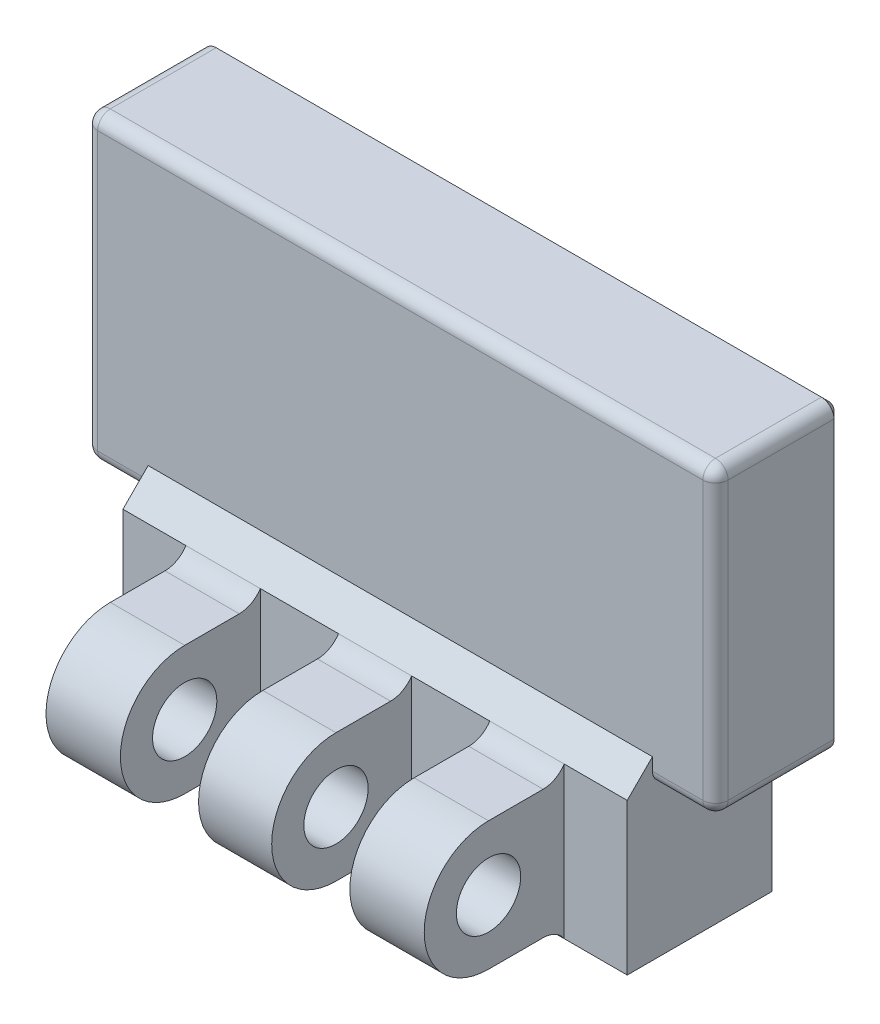
from build123d import *

# Parameters (mm, degrees)
SKETCH1_W           = 40
SKETCH1_H           = 12
SKETCH1_R           = 4.05
BOSS_EXTRUDE1_DEPTH = 6
SKETCH3_R           = 2.55
BOSS_EXTRUDE2_DEPTH = 15
CUT_EXTRUDE1_START  = -2.9
SKETCH3_2_R         = 2.55
CUT_EXTRUDE1_DEPTH  = 6.2
BOSS_EXTRUDE3_START = -3
SKETCH5_R           = 4.05
BOSS_EXTRUDE3_DEPTH = 3
SKETCH6_W           = 50
SKETCH6_H           = 24
BOSS_EXTRUDE4_DEPTH = 10
SKETCH8_W           = 11
SKETCH8_H           = 12
CUT_EXTRUDE2_DEPTH  = 8
CHAMFER1_SIZE       = 2
FILLET1_R           = 1
FILLET2_R           = 1
CHAMFER2_SIZE       = 0.6
CHAMFER3_SIZE       = 0.5
FILLET3_R           = 2


# Some blends are built 0.0001 mm under size
with BuildPart() as part:
    # Sketch1 → Boss-Extrude1 (new, symmetric)
    with BuildSketch(Plane.XY):
        Rectangle(SKETCH1_W, SKETCH1_H)
        with Locations((11, 0)):
            Circle(SKETCH1_R, mode=Mode.SUBTRACT)
        with Locations(Location((-11, 0, 0), (0, 0, 180))):
            Circle(SKETCH1_R, mode=Mode.SUBTRACT)
    extrude(amount=BOSS_EXTRUDE1_DEPTH, both=True)

    # Sketch3 → Boss-Extrude2 (add, symmetric)
    with BuildSketch(Plane(origin=(0, 0, 0), x_dir=(0, 0, -1), z_dir=(1, 0, 0))):
        with BuildLine():
            Line((-12, -5.1), (-6, -5.1))
            Line((-6, -5.1), (-6, 5.1))
            Line((-6, 5.1), (-12, 5.1))
            ThreePointArc((-12, 5.1), (-17.1, 0), (-12, -5.1))
        make_face()
        with Locations((-12, 0)):
            Circle(SKETCH3_R, mode=Mode.SUBTRACT)
    extrude(amount=BOSS_EXTRUDE2_DEPTH, both=True)

    # Sketch3<2> → Cut-Extrude1 (cut)
    with BuildSketch(Plane(origin=(0, 0, 0), x_dir=(0, 0, -1), z_dir=(1, 0, 0)).offset(CUT_EXTRUDE1_START)):
        with BuildLine():
            Line((-12, -5.1), (-6, -5.1))
            Line((-6, -5.1), (-6, 5.1))
            Line((-6, 5.1), (-12, 5.1))
            ThreePointArc((-12, 5.1), (-17.1, 0), (-12, -5.1))
        make_face()
        with Locations((-12, 0)):
            Circle(SKETCH3_2_R, mode=Mode.SUBTRACT)
    cut_extrude1 = extrude(amount=-CUT_EXTRUDE1_DEPTH, mode=Mode.SUBTRACT)

    # Mirror1: Cut-Extrude1 across plane
    add(cut_extrude1.mirror(Plane(origin=(0, 0, 0), x_dir=(0, 0, 1), z_dir=(1, 0, 0))), mode=Mode.SUBTRACT)

    # Sketch5 → Boss-Extrude3 (add)
    with BuildSketch(Plane.XY.offset(6).offset(BOSS_EXTRUDE3_START)):
        with Locations(Location((-11, 0, 0), (0, 0, 180))):
            Circle(SKETCH5_R)
        with Locations((11, 0)):
            Circle(SKETCH5_R)
    extrude(amount=BOSS_EXTRUDE3_DEPTH)

    # Sketch6 → Boss-Extrude4 (add)
    with BuildSketch(Plane(origin=(0, 0, -6), x_dir=(-1, 0, 0), z_dir=(0, 0, -1))):
        with Locations((0, 18)):
            Rectangle(SKETCH6_W, SKETCH6_H)
    extrude(amount=-BOSS_EXTRUDE4_DEPTH)

    # Sketch8 → Cut-Extrude2 (cut)
    with BuildSketch(Plane(origin=(0, 0, -6), x_dir=(-1, 0, 0), z_dir=(0, 0, -1))):
        Rectangle(SKETCH8_W, SKETCH8_H)
        Polygon((-23, 27), (-23, 6), (-20, 6), (-5.5, 6), (5.5, 6), (20, 6), (23, 6), (23, 27), align=None)
    extrude(amount=-CUT_EXTRUDE2_DEPTH, mode=Mode.SUBTRACT)

    # Chamfer1
    chamfer1_edges = [part.edges().sort_by_distance(p)[0] for p in [
        (0, 6, 4),
    ]]
    chamfer(chamfer1_edges, length=CHAMFER1_SIZE - 0.0001)  # a hair under: the kernel refuses the full size

    # Fillet1
    fillet1_edges = [part.edges().sort_by_distance(p)[0] for p in [
        (25, 18, 4),
        (0, 30, 4),
        (-25, 18, 4),
    ]]
    fillet(fillet1_edges, radius=FILLET1_R)

    # Fillet2
    # the kernel refuses this fillet: 1 mm, written as the material it takes off along each edge
    with BuildSketch(Plane(origin=(24, 29, 3), x_dir=(0, 1, 0), z_dir=(1, 0, 0))) as fillet2_piece_1_section:
        Polygon((0, 0), (FILLET2_R, 0), (FILLET2_R, FILLET2_R), (0, FILLET2_R), align=None)
    fillet2_piece_1 = extrude(amount=FILLET2_R, mode=Mode.PRIVATE)
    fillet2_piece_1 = fillet2_piece_1 - Plane(origin=(24, 29, 3), x_dir=(0, -0.7071067811865475, -0.7071067811865475), z_dir=(1, 0, 0)) * Sphere(FILLET2_R, mode=Mode.PRIVATE)
    add(fillet2_piece_1, mode=Mode.SUBTRACT)
    with BuildSketch(Plane(origin=(-24, 29, 3), x_dir=(-1, 0, 0), z_dir=(0, 1, 0))) as fillet2_piece_2_section:
        Polygon((0, 0), (FILLET2_R, 0), (FILLET2_R, FILLET2_R), (0, FILLET2_R), align=None)
    fillet2_piece_2 = extrude(amount=FILLET2_R, mode=Mode.PRIVATE)
    fillet2_piece_2 = fillet2_piece_2 - Plane(origin=(-24, 29, 3), x_dir=(0.7071067811865475, 0, -0.7071067811865475), z_dir=(0, 1, 0)) * Sphere(FILLET2_R, mode=Mode.PRIVATE)
    add(fillet2_piece_2, mode=Mode.SUBTRACT)
    with BuildSketch(Plane(origin=(-20, 6, 4), x_dir=(0, 1, 0), z_dir=(-1, 0, 0)), Plane(origin=(24, 6, 4), x_dir=(0, 1, 0), z_dir=(-1, 0, 0))) as fillet2_piece_3:
        with BuildLine():
            CenterArc((FILLET2_R, FILLET2_R), FILLET2_R, 180, 90)
            Line((0, FILLET2_R), (0, 0))
            Line((0, 0), (FILLET2_R, 0))
        make_face()
    extrude(amount=4, mode=Mode.SUBTRACT)
    with BuildSketch(Plane(origin=(-25, 6, -8.5), x_dir=(1, 0, 0), z_dir=(0, 0, 1))) as fillet2_piece_4:
        with BuildLine():
            CenterArc((FILLET2_R, FILLET2_R), FILLET2_R, 180, 90)
            Line((0, FILLET2_R), (0, 0))
            Line((0, 0), (FILLET2_R, 0))
        make_face()
    extrude(amount=11.5, mode=Mode.SUBTRACT)
    with BuildSketch(Plane(origin=(-25, 30, -8.5), x_dir=(1, 0, 0), z_dir=(0, 0, 1)), Plane(origin=(25, 30, -8.5), x_dir=(0, -1, 0), z_dir=(0, 0, 1)), Plane(origin=(25, 6, -8.5), x_dir=(-1, 0, 0), z_dir=(0, 0, 1))) as fillet2_piece_5:
        with BuildLine():
            CenterArc((FILLET2_R, -FILLET2_R), FILLET2_R, 90, 90)
            Line((0, -FILLET2_R), (0, 0))
            Line((0, 0), (FILLET2_R, 0))
        make_face()
    extrude(amount=11.5, mode=Mode.SUBTRACT)
    with BuildSketch(Plane(origin=(-24, 6, 3), x_dir=(0, 0, 1), z_dir=(1, 0, 0))) as fillet2_piece_6:
        with BuildLine():
            CenterArc((1 - FILLET2_R, -FILLET2_R), FILLET2_R, 0, 90)
            Line((1 - FILLET2_R, 0), (1, 0))
            Line((1, 0), (1, -FILLET2_R))
        make_face()
    revolve(axis=Axis((-24, 6, 3), (0, -1, 0)), revolution_arc=90, mode=Mode.SUBTRACT)
    with BuildSketch(Plane(origin=(24, 6, 3), x_dir=(0, 0, 1), z_dir=(-1, 0, 0))) as fillet2_piece_7:
        with BuildLine():
            CenterArc((1 - FILLET2_R, FILLET2_R), FILLET2_R, 270, 90)
            Line((1, FILLET2_R), (1, 0))
            Line((1, 0), (1 - FILLET2_R, 0))
        make_face()
    revolve(axis=Axis((24, 6, 3), (0, 1, 0)), revolution_arc=90, mode=Mode.SUBTRACT)

    # Chamfer2
    chamfer2_edges = [part.edges().sort_by_distance(p)[0] for p in [
        (-23.5, 6, -6),
        (23.5, 6, -6),
        (-25, 18, -6),
        (0, 30, -6),
        (25, 18, -6),
        (24.707106781, 29.707106781, -6),
        (-24.707106781, 29.707106781, -6),
        (24.707106781, 6.292893219, -6),
        (-24.707106781, 6.292893219, -6),
    ]]
    chamfer(chamfer2_edges, length=CHAMFER2_SIZE)

    # Chamfer3
    chamfer3_edges = [part.edges().sort_by_distance(p)[0] for p in [
        (12.75, -6, -6),
        (6.95, 0, -6),
        (-5.5, 0, -6),
        (-12.75, 6, -6),
        (12.75, 6, -6),
        (5.5, 0, -6),
        (-6.95, 0, -6),
        (-12.75, -6, -6),
        (-20, 0, -6),
        (20, 0, -6),
    ]]
    chamfer(chamfer3_edges, length=CHAMFER3_SIZE)

    # Fillet3
    # the kernel refuses this fillet: 2 mm, written as the material it adds along each edge
    with BuildSketch(Plane(origin=(9.1, -5.1, 6), x_dir=(0, -1.0, 1.5355618011688864e-12), z_dir=(1, 0, 0)), Plane(origin=(-15, -5.1, 6), x_dir=(0, -1.0, 1.5355618011688864e-12), z_dir=(1, 0, 0))) as fillet3_piece_1:
        with BuildLine():
            CenterArc((2, -1.670329309), FILLET3_R, 123.367012969, 56.632987031)
            Line((0, -1.670329309), (-0.04, -1.670329309))
            Line((-0.04, -1.670329309), (-0.04, 0))
            Line((-0.04, 0), (0, 0.04))
            ThreePointArc((0, 0.04), (0.45, 0.04), (0.878, 0.033406586))
            Line((0.878, 0.033406586), (0.9, 0))
        make_face()
    extrude(amount=5.9)
    with BuildSketch(Plane(origin=(9.1, 5.1, 6), x_dir=(0, 1.0, 1.5326012064365571e-12), z_dir=(1, 0, 0)), Plane(origin=(-15, 5.1, 6), x_dir=(0, 1.0, 1.5326012064365571e-12), z_dir=(1, 0, 0))) as fillet3_piece_2:
        with BuildLine():
            CenterArc((2, 1.670329309), FILLET3_R, 180, 56.632987031)
            Line((0, 1.670329309), (-0.04, 1.670329309))
            Line((-0.04, 1.670329309), (-0.04, 0))
            Line((-0.04, 0), (0, -0.04))
            ThreePointArc((0, -0.04), (0.45, -0.04), (0.878, -0.033406586))
            Line((0.878, -0.033406586), (0.9, 0))
        make_face()
    extrude(amount=5.9)
    with BuildSketch(Plane(origin=(-2.9, 5.1, 6), x_dir=(0, 1.0, 1.5326012064365571e-12), z_dir=(1, 0, 0))) as fillet3_piece_3:
        with BuildLine():
            CenterArc((2, 1.670329309), FILLET3_R, 180, 56.632987031)
            Line((0, 1.670329309), (-0.04, 1.670329309))
            Line((-0.04, 1.670329309), (-0.04, 0))
            Line((-0.04, 0), (0, -0.04))
            ThreePointArc((0, -0.04), (0.45, -0.04), (0.878, -0.033406586))
            Line((0.878, -0.033406586), (0.9, 0))
        make_face()
    extrude(amount=5.8)
    with BuildSketch(Plane(origin=(-2.9, -5.1, 6), x_dir=(0, -1.0, 1.5355618011688864e-12), z_dir=(1, 0, 0))) as fillet3_piece_4:
        with BuildLine():
            CenterArc((2, -1.670329309), FILLET3_R, 123.367012969, 56.632987031)
            Line((0, -1.670329309), (-0.04, -1.670329309))
            Line((-0.04, -1.670329309), (-0.04, 0))
            Line((-0.04, 0), (0, 0.04))
            ThreePointArc((0, 0.04), (0.45, 0.04), (0.878, 0.033406586))
            Line((0.878, 0.033406586), (0.9, 0))
        make_face()
    extrude(amount=5.8)


solid = part.part
